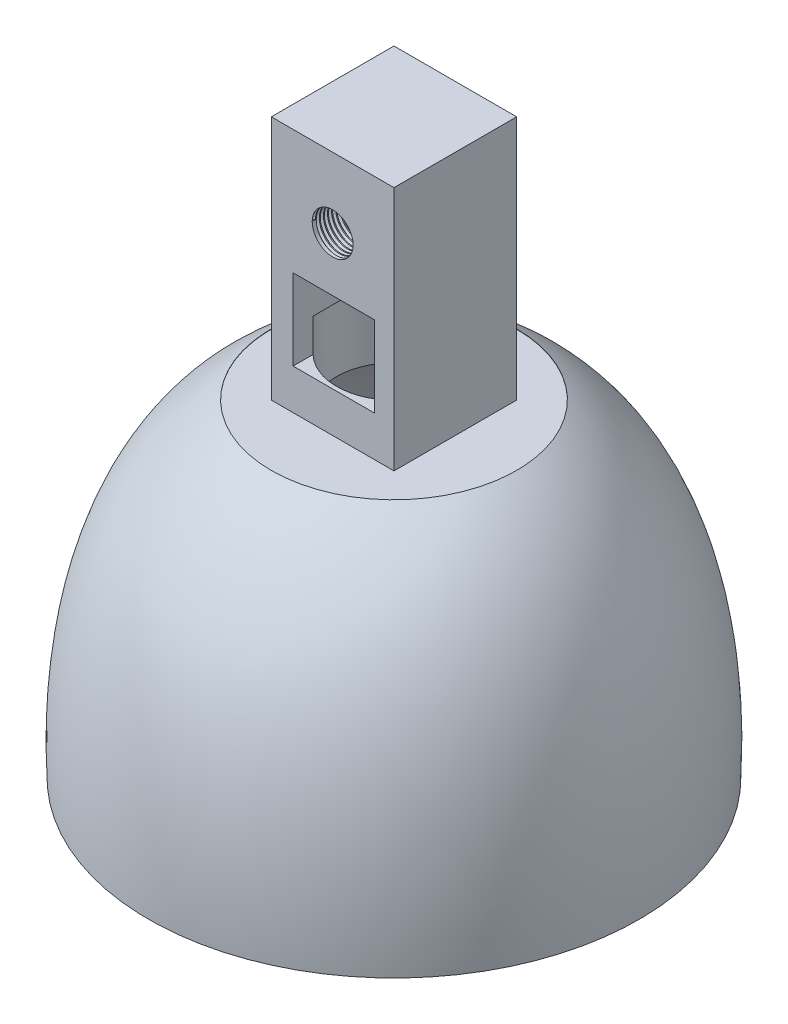
from build123d import *

# Parameters (mm, degrees)
SHELL1_T            = -2.54
SKETCH5_W           = 38.1
SKETCH5_H           = 38.1
BOSS_EXTRUDE2_DEPTH = 76.2
SKETCH6_R           = 6.35
CUT_EXTRUDE2_DEPTH  = 76.2
THREAD2_PITCH       = 1.27
SKETCH11_R          = 17.78
CUT_EXTRUDE5_DEPTH  = 25.4
SKETCH12_W          = 25.238405076
SKETCH12_H          = 25.089065401
CUT_EXTRUDE6_DEPTH  = 216.801532847


with BuildPart() as part:
    # Sketch2 → Revolve1 (revolve)
    with BuildSketch(Plane.XY, mode=Mode.PRIVATE) as revolve1_sk:
        with BuildLine():
            Line((0, 0), (0, 101.6))
            Line((0, 101.6), (38.1, 101.6))
            Line((38.1, 101.6), (38.1, 101.714932127))
            add(Edge.make_bspline(
                [(38.1, 101.714932127), (71.032805343, 80.770620095), (77.857214019, 35.355979161), (76.2, 0)],
                knots=[0, 0, 0, 0, 1, 1, 1, 1], degree=3))
            Line((76.2, 0), (0, 0))
        make_face()
    revolve(revolve1_sk.sketch.rotate(Axis((0, 0, 0), (0, 1, 0)), 90), axis=Axis((0, 0, 0), (0, 1, 0)))

    # Shell1
    shell1_openings = [part.faces().sort_by_distance(p)[0] for p in [
        (0, 0, 0),
    ]]
    offset(amount=SHELL1_T, openings=shell1_openings)

    # Sketch5 → Boss-Extrude2 (add)
    with BuildSketch(Plane(origin=(0, 101.6, 0), x_dir=(1, 0, 0), z_dir=(0, 1, 0))):
        Rectangle(SKETCH5_W, SKETCH5_H)
    extrude(amount=BOSS_EXTRUDE2_DEPTH)

    # Sketch6 → Cut-Extrude2 (cut)
    with BuildSketch(Plane(origin=(0, 0, -19.05), x_dir=(-1, 0, 0), z_dir=(0, 0, -1))):
        with Locations((0, 155.984499761)):
            Circle(SKETCH6_R)
    extrude(amount=-CUT_EXTRUDE2_DEPTH, mode=Mode.SUBTRACT)

    # Thread2: arcs per turn and ends read off the stored shape
    # Thread2: the profile of Thread Profile2 profile screwed along a right-hand helix through 30 turns, 8 arcs to a turn; built about Z, then put on its axis
    thread2_z = Axis((0, 0, 0), (0, 0, 1))
    thread2_corners = [(6.3497, 0, -0.000173205), (7.037407661, 0, 0.396874998), (7.037407661, 0, 0.555624998), (6.3497, 0, 0.952673202)]
    with BuildLine(mode=Mode.PRIVATE) as thread2_profile:
        Line(thread2_corners[0], thread2_corners[1])
        Line(thread2_corners[1], thread2_corners[2])
        Line(thread2_corners[2], thread2_corners[3])
        Line(thread2_corners[3], thread2_corners[0])
    thread2_cap = Face(thread2_profile.wire())
    thread2_turn_angles = [0, 22.5, 45, 67.5, 90, 112.5, 135, 157.5, 180, 202.5, 225, 247.5, 270, 292.5, 315, 337.5, 360]
    thread2_turn_weights = [1, 0.9238795325112867, 1, 0.9238795325112867, 1, 0.9238795325112867, 1, 0.9238795325112867, 1, 0.9238795325112867, 1, 0.9238795325112867, 1, 0.9238795325112867, 1, 0.9238795325112867, 1]
    thread2_turn_rails = [Edge.make_bspline([Vector(p[0], p[1], 0).rotate(thread2_z, thread2_turn_angles[k]) / thread2_turn_weights[k] + Vector(0, 0, p[2] + THREAD2_PITCH * thread2_turn_angles[k] / 360) for k in range(17)], [0, 0, 0, 1, 1, 2, 2, 3, 3, 4, 4, 5, 5, 6, 6, 7, 7, 8, 8, 8], 2, thread2_turn_weights) for p in thread2_corners]
    thread2_turn_sides = [Face.make_surface_from_curves(thread2_turn_rails[p[0]], thread2_turn_rails[p[1]]) for p in [(0, 1), (1, 2), (2, 3), (3, 0)]]
    thread2 = Plane(origin=(0, 155.984499761, 19.05), x_dir=(-1, 0, 0), z_dir=(0, 0, -1)) * Solid(Shell([*[p.moved(Location((0, 0, THREAD2_PITCH * i))) for i in range(30) for p in thread2_turn_sides], thread2_cap, thread2_cap.rotate(thread2_z, 10800).moved(Location((0, 0, THREAD2_PITCH * 10800 / 360)))]))
    add(thread2, mode=Mode.SUBTRACT)

    # Sketch11 → Cut-Extrude5 (cut)
    with BuildSketch(Plane.XZ.offset(-99.06)):
        with Locations(Location((0, 0, 0), (0, 0, 270))):
            Circle(SKETCH11_R)
    extrude(amount=-CUT_EXTRUDE5_DEPTH, mode=Mode.SUBTRACT)

    # Sketch12 → Cut-Extrude6 (cut, through all)
    with BuildSketch(Plane.XY.offset(19.05)):
        with Locations((0.324364543, 126.673507391)):
            Rectangle(SKETCH12_W, SKETCH12_H)
    extrude(amount=-CUT_EXTRUDE6_DEPTH, mode=Mode.SUBTRACT)


solid = part.part
